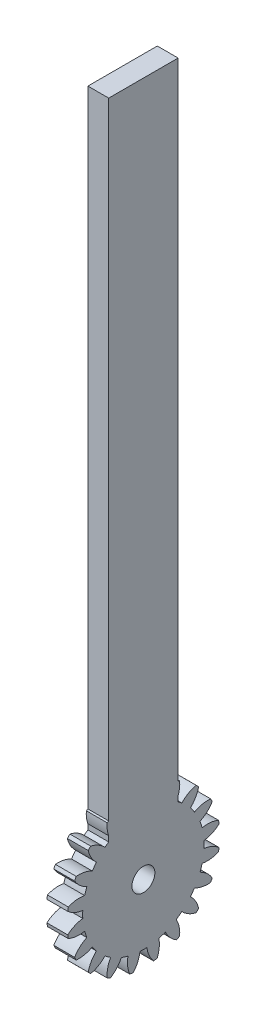
from build123d import *

# Parameters (mm, degrees)
BASPROSKE_W         = 3
BASPROSKE_H         = 11
TOOTHCUT_DEPTH      = 16.842979518
TEETHCUTS_COUNT     = 20
TEETHCUTS_ANGLE     = 342
BORSKE_R            = 2.5
BORE_DEPTH          = 50.0000508
SKETCH1_W           = 10
SKETCH1_H           = 100
BOSS_EXTRUDE1_DEPTH = 3
CUT_EXTRUDE2_DEPTH  = 3
SKETCH6_R           = 2.5
SKETCH6_R_2         = 1.65
BOSS_EXTRUDE2_DEPTH = 3


with BuildPart() as part:
    # BasProSke → Base-Revolve (revolve)
    with BuildSketch(Plane(origin=(0, 0, 0), x_dir=(1, 0, 0), z_dir=(0, 1, 0))):
        with Locations((1.5, 5.5)):
            Rectangle(BASPROSKE_W, BASPROSKE_H)
    revolve(axis=Axis((-10, 0, 0), (1, 0, 0)))

    # TooCutSke → ToothCut (cut, through all)
    with BuildSketch(Plane(origin=(0, 0, 0), x_dir=(0, 0, -1), z_dir=(1, 0, 0))):
        with BuildLine():
            ThreePointArc((0.499924007, 8.734705318), (0, 8.749), (-0.499924007, 8.734705318))
            ThreePointArc((-0.499924007, 8.734705318), (-0.824302243, 9.905497836), (-1.485192705, 10.924909509))
            ThreePointArc((-1.485192705, 10.924909509), (0, 11.0254), (1.485192705, 10.924909509))
            ThreePointArc((1.485192705, 10.924909509), (0.824302243, 9.905497836), (0.499924007, 8.734705318))
        make_face()
    toothcut = extrude(amount=TOOTHCUT_DEPTH, mode=Mode.SUBTRACT)

    # TeethCuts: ToothCut ×20 about axis
    teethcuts_axis = Axis((-10, 0, 0), (1, 0, 0))
    for i in range(1, TEETHCUTS_COUNT):
        add(toothcut.rotate(teethcuts_axis, i * TEETHCUTS_ANGLE / (TEETHCUTS_COUNT - 1)), mode=Mode.SUBTRACT)

    # BorSke → Bore (cut, symmetric)
    with BuildSketch(Plane(origin=(0, 0, 0), x_dir=(0, 0, -1), z_dir=(1, 0, 0))):
        Circle(BORSKE_R)
    extrude(amount=BORE_DEPTH, both=True, mode=Mode.SUBTRACT)

    # Sketch1 → Boss-Extrude1 (add)
    with BuildSketch(Plane(origin=(3, 0, 0), x_dir=(0, 0, -1), z_dir=(1, 0, 0))):
        with Locations((0, 50)):
            Rectangle(SKETCH1_W, SKETCH1_H)
    extrude(amount=-BOSS_EXTRUDE1_DEPTH)

    # Sketch5 → Cut-Extrude2 (cut)
    with BuildSketch(Plane(origin=(3, 0, 0), x_dir=(0, 0, -1), z_dir=(1, 0, 0))):
        with BuildLine():
            Line((2.5, 0), (-2.5, 0))
            ThreePointArc((-2.5, 0), (0, 2.5), (2.5, 0))
        make_face()
    extrude(amount=-CUT_EXTRUDE2_DEPTH, mode=Mode.SUBTRACT)

    # Sketch6 → Boss-Extrude2 (add)
    with BuildSketch(Plane(origin=(3, 0, 0), x_dir=(0, 0, -1), z_dir=(1, 0, 0))):
        Circle(SKETCH6_R)
        Circle(SKETCH6_R_2, mode=Mode.SUBTRACT)
    extrude(amount=-BOSS_EXTRUDE2_DEPTH)


solid = part.part
